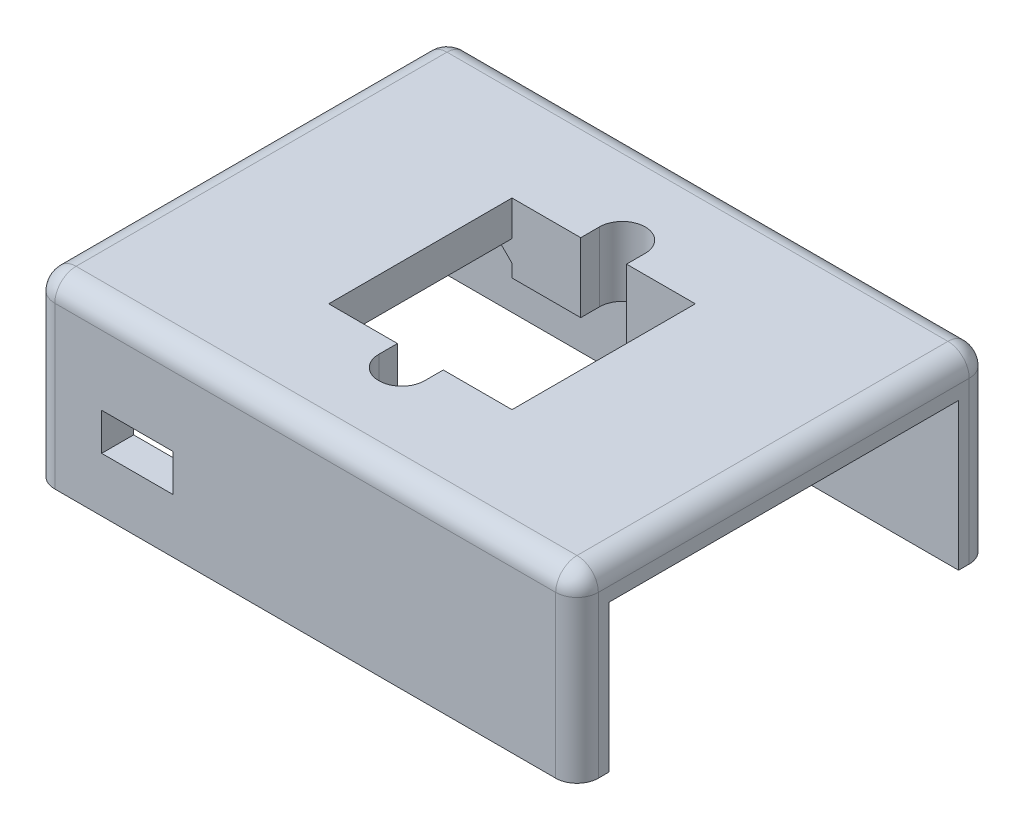
from build123d import *

# Parameters (mm, degrees)
CROQUIS2_W              = 51
CROQUIS2_H              = 38.8
SALIENTE_EXTRUIR2_DEPTH = 12.5
CROQUIS8_W              = 45
CROQUIS8_H              = 32.8
CORTAR_EXTRUIR3_DEPTH   = 6
CROQUIS10_W             = 17.2
CROQUIS10_H             = 17.2
CORTAR_EXTRUIR4_DEPTH   = 10
CROQUIS12_W             = 7.2
CROQUIS12_H             = 32.8
CORTAR_EXTRUIR5_DEPTH   = 3.2
CROQUIS13_W             = 13.9
CROQUIS13_H             = 32.8
CORTAR_EXTRUIR6_DEPTH   = 3.2
CROQUIS14_W             = 32.8
CROQUIS14_H             = 9.2
CORTAR_EXTRUIR7_DEPTH   = 3.2
CROQUIS16_W             = 32.8
CROQUIS16_H             = 9.2
CORTAR_EXTRUIR8_DEPTH   = 3.2
CROQUIS17_W             = 51
CROQUIS17_H             = 3
SALIENTE_EXTRUIR3_DEPTH = 4.6
CROQUIS18_W             = 6.7
CROQUIS18_H             = 3.5
CORTAR_EXTRUIR9_DEPTH   = 4.6
CROQUIS19_W             = 6.7
CROQUIS19_H             = 3.5
CORTAR_EXTRUIR10_DEPTH  = 4.6
REDONDEO1_R             = 2
CROQUIS22_R             = 1
CORTAR_EXTRUIR11_DEPTH  = 2
REDONDEO2_R             = 2
CHAFL_N1_SIZE           = 2
CHAFL_N2_SIZE           = 2
CORTAR_EXTRUIR12_DEPTH  = 10


with BuildPart() as part:
    # Croquis2 → Saliente-Extruir2 (new body)
    with BuildSketch(Plane(origin=(0, 0, 0), x_dir=(1, 0, 0), z_dir=(0, 1, 0))):
        with Locations((-5.045084746, 11.269745763)):
            Rectangle(CROQUIS2_W, CROQUIS2_H)
    extrude(amount=SALIENTE_EXTRUIR2_DEPTH)

    # Croquis8 → Cortar-Extruir3 (cut)
    with BuildSketch(Plane.XZ):
        with Locations((-5.045084746, -11.269745763)):
            Rectangle(CROQUIS8_W, CROQUIS8_H)
    extrude(amount=-CORTAR_EXTRUIR3_DEPTH, mode=Mode.SUBTRACT)

    # Croquis10 → Cortar-Extruir4 (cut)
    with BuildSketch(Plane(origin=(0, 12.5, 0), x_dir=(1, 0, 0), z_dir=(0, 1, 0))):
        with Locations((-5.045084746, 11.269745763)):
            Rectangle(CROQUIS10_W, CROQUIS10_H)
    extrude(amount=-CORTAR_EXTRUIR4_DEPTH, mode=Mode.SUBTRACT)

    # Croquis12 → Cortar-Extruir5 (cut)
    with BuildSketch(Plane.XZ.offset(-6)):
        with Locations((13.854915254, -11.269745763)):
            Rectangle(CROQUIS12_W, CROQUIS12_H)
    extrude(amount=-CORTAR_EXTRUIR5_DEPTH, mode=Mode.SUBTRACT)

    # Croquis13 → Cortar-Extruir6 (cut)
    with BuildSketch(Plane.XZ.offset(-6)):
        with Locations((-20.595084746, -11.269745763)):
            Rectangle(CROQUIS13_W, CROQUIS13_H)
    extrude(amount=-CORTAR_EXTRUIR6_DEPTH, mode=Mode.SUBTRACT)

    # Croquis14 → Cortar-Extruir7 (cut)
    with BuildSketch(Plane(origin=(20.454915254, 0, 0), x_dir=(0, 0, -1), z_dir=(1, 0, 0))):
        with Locations((11.269745763, 4.6)):
            Rectangle(CROQUIS14_W, CROQUIS14_H)
    extrude(amount=-CORTAR_EXTRUIR7_DEPTH, mode=Mode.SUBTRACT)

    # Croquis16 → Cortar-Extruir8 (cut)
    with BuildSketch(Plane.ZY.offset(30.545084746)):
        with Locations((-11.269745763, 4.6)):
            Rectangle(CROQUIS16_W, CROQUIS16_H)
    extrude(amount=-CORTAR_EXTRUIR8_DEPTH, mode=Mode.SUBTRACT)

    # Croquis17 → Saliente-Extruir3 (add)
    with BuildSketch(Plane.XZ):
        with Locations((-5.045084746, 6.630254237)):
            Rectangle(CROQUIS17_W, CROQUIS17_H)
        with Locations((-5.045084746, -29.169745763)):
            Rectangle(CROQUIS17_W, CROQUIS17_H)
    extrude(amount=SALIENTE_EXTRUIR3_DEPTH)

    # Croquis18 → Cortar-Extruir9 (cut)
    with BuildSketch(Plane.XY.offset(8.130254237)):
        with Locations((-20.795084746, 2.25)):
            Rectangle(CROQUIS18_W, CROQUIS18_H)
    extrude(amount=-CORTAR_EXTRUIR9_DEPTH, mode=Mode.SUBTRACT)

    # Croquis19 → Cortar-Extruir10 (cut)
    with BuildSketch(Plane(origin=(0, 0, -30.669745763), x_dir=(-1, 0, 0), z_dir=(0, 0, -1))):
        with Locations((20.795084746, 2.25)):
            Rectangle(CROQUIS19_W, CROQUIS19_H)
    extrude(amount=-CORTAR_EXTRUIR10_DEPTH, mode=Mode.SUBTRACT)

    # Redondeo1
    redondeo1_edges = [part.edges().sort_by_distance(p)[0] for p in [
        (20.454915254, 12.5, -11.269745763),
        (-5.045084746, 12.5, -30.669745763),
        (-30.545084746, 12.5, -11.269745763),
        (-5.045084746, 12.5, 8.130254237),
    ]]
    fillet(redondeo1_edges, radius=REDONDEO1_R)

    # Croquis22 → Cortar-Extruir11 (cut)
    with BuildSketch(Plane.XZ.offset(4.6)):
        with Locations(Location((-27.545084746, 6.630254237, 0), (0, 0, 270))):
            Circle(CROQUIS22_R)
        with Locations(Location((-5.045084746, 6.630254237, 0), (0, 0, 270))):
            Circle(CROQUIS22_R)
        with Locations(Location((17.454915254, 6.630254237, 0), (0, 0, 270))):
            Circle(CROQUIS22_R)
        with Locations(Location((17.454915254, -29.169745763, 0), (0, 0, 90))):
            Circle(CROQUIS22_R)
        with Locations(Location((-5.045084746, -29.169745763, 0), (0, 0, 90))):
            Circle(CROQUIS22_R)
        with Locations(Location((-27.545084746, -29.169745763, 0), (0, 0, 90))):
            Circle(CROQUIS22_R)
    extrude(amount=-CORTAR_EXTRUIR11_DEPTH, mode=Mode.SUBTRACT)

    # Redondeo2
    # the kernel refuses this fillet: 2 mm, written as the material it takes off along each edge
    with BuildSketch(Plane(origin=(18.454915254, 10.5, -28.669745763), x_dir=(1, 0, 0), z_dir=(0, 0, -1))) as redondeo2_piece_1_section:
        Polygon((0, 0), (REDONDEO2_R, 0), (REDONDEO2_R, -REDONDEO2_R), (0, -REDONDEO2_R), align=None)
    redondeo2_piece_1 = extrude(amount=REDONDEO2_R, mode=Mode.PRIVATE)
    redondeo2_piece_1 = redondeo2_piece_1 - Plane(origin=(18.454915254, 10.5, -28.669745763), x_dir=(-0.7071067811865475, -0.7071067811865475, 0), z_dir=(0, 0, -1)) * Sphere(REDONDEO2_R, mode=Mode.PRIVATE)
    add(redondeo2_piece_1, mode=Mode.SUBTRACT)
    with BuildSketch(Plane(origin=(18.454915254, 10.5, 6.130254237), x_dir=(0, 0, 1), z_dir=(1, 0, 0))) as redondeo2_piece_2_section:
        Polygon((0, 0), (REDONDEO2_R, 0), (REDONDEO2_R, -REDONDEO2_R), (0, -REDONDEO2_R), align=None)
    redondeo2_piece_2 = extrude(amount=REDONDEO2_R, mode=Mode.PRIVATE)
    redondeo2_piece_2 = redondeo2_piece_2 - Plane(origin=(18.454915254, 10.5, 6.130254237), x_dir=(0, -0.7071067811865475, -0.7071067811865475), z_dir=(1, 0, 0)) * Sphere(REDONDEO2_R, mode=Mode.PRIVATE)
    add(redondeo2_piece_2, mode=Mode.SUBTRACT)
    with BuildSketch(Plane(origin=(-28.545084746, 10.5, -28.669745763), x_dir=(-1, 0, 0), z_dir=(0, 0, -1))) as redondeo2_piece_3_section:
        Polygon((0, 0), (REDONDEO2_R, 0), (REDONDEO2_R, REDONDEO2_R), (0, REDONDEO2_R), align=None)
    redondeo2_piece_3 = extrude(amount=REDONDEO2_R, mode=Mode.PRIVATE)
    redondeo2_piece_3 = redondeo2_piece_3 - Plane(origin=(-28.545084746, 10.5, -28.669745763), x_dir=(0.7071067811865475, -0.7071067811865475, 0), z_dir=(0, 0, -1)) * Sphere(REDONDEO2_R, mode=Mode.PRIVATE)
    add(redondeo2_piece_3, mode=Mode.SUBTRACT)
    with BuildSketch(Plane(origin=(-28.545084746, 10.5, 6.130254237), x_dir=(0, 0, 1), z_dir=(-1, 0, 0))) as redondeo2_piece_4_section:
        Polygon((0, 0), (REDONDEO2_R, 0), (REDONDEO2_R, REDONDEO2_R), (0, REDONDEO2_R), align=None)
    redondeo2_piece_4 = extrude(amount=REDONDEO2_R, mode=Mode.PRIVATE)
    redondeo2_piece_4 = redondeo2_piece_4 - Plane(origin=(-28.545084746, 10.5, 6.130254237), x_dir=(0, -0.7071067811865475, -0.7071067811865475), z_dir=(-1, 0, 0)) * Sphere(REDONDEO2_R, mode=Mode.PRIVATE)
    add(redondeo2_piece_4, mode=Mode.SUBTRACT)
    with BuildSketch(Plane(origin=(-30.545084746, -9.6, -30.669745763), x_dir=(1, 0, 0), z_dir=(0, 1, 0)), Plane(origin=(-30.545084746, -9.6, 8.130254237), x_dir=(0, 0, -1), z_dir=(0, 1, 0)), Plane(origin=(20.454915254, 10.5, 8.130254237), x_dir=(0, 0, -1), z_dir=(0, -1, 0)), Plane(origin=(20.454915254, 10.5, -30.669745763), x_dir=(-1, 0, 0), z_dir=(0, -1, 0))) as redondeo2_piece_5:
        with BuildLine():
            CenterArc((REDONDEO2_R, -REDONDEO2_R), REDONDEO2_R, 90, 90)
            Line((0, -REDONDEO2_R), (0, 0))
            Line((0, 0), (REDONDEO2_R, 0))
        make_face()
    extrude(amount=20.1, mode=Mode.SUBTRACT)

    # Chaflán1
    chafl_n1_edges = [part.edges().sort_by_distance(p)[0] for p in [
        (-13.645084746, 9.2, 1.230254237),
        (-13.645084746, 9.2, -23.769745763),
    ]]
    chamfer(chafl_n1_edges, length=CHAFL_N1_SIZE)

    # Chaflán2
    chafl_n2_edges = [part.edges().sort_by_distance(p)[0] for p in [
        (10.254915254, 9.2, -11.269745763),
    ]]
    chamfer(chafl_n2_edges, length=CHAFL_N2_SIZE)

    # Croquis27 → Cortar-Extruir12 (cut)
    with BuildSketch(Plane(origin=(0, 12.5, 0), x_dir=(1, 0, 0), z_dir=(0, 1, 0))):
        with BuildLine():
            Line((-7.195084746, 2.669745763), (-2.895084746, 2.669745763))
            Line((-2.895084746, 2.669745763), (-2.895084746, 0.919745763))
            ThreePointArc((-2.895084746, 0.919745763), (-5.045084746, -1.230254237), (-7.195084746, 0.919745763))
            Line((-7.195084746, 0.919745763), (-7.195084746, 2.669745763))
        make_face()
        with BuildLine():
            Line((-7.195084746, 19.869745763), (-2.895084746, 19.869745763))
            Line((-2.895084746, 19.869745763), (-2.895084746, 21.619745763))
            ThreePointArc((-2.895084746, 21.619745763), (-5.045084746, 23.769745763), (-7.195084746, 21.619745763))
            Line((-7.195084746, 21.619745763), (-7.195084746, 19.869745763))
        make_face()
    extrude(amount=-CORTAR_EXTRUIR12_DEPTH, mode=Mode.SUBTRACT)


solid = part.part
